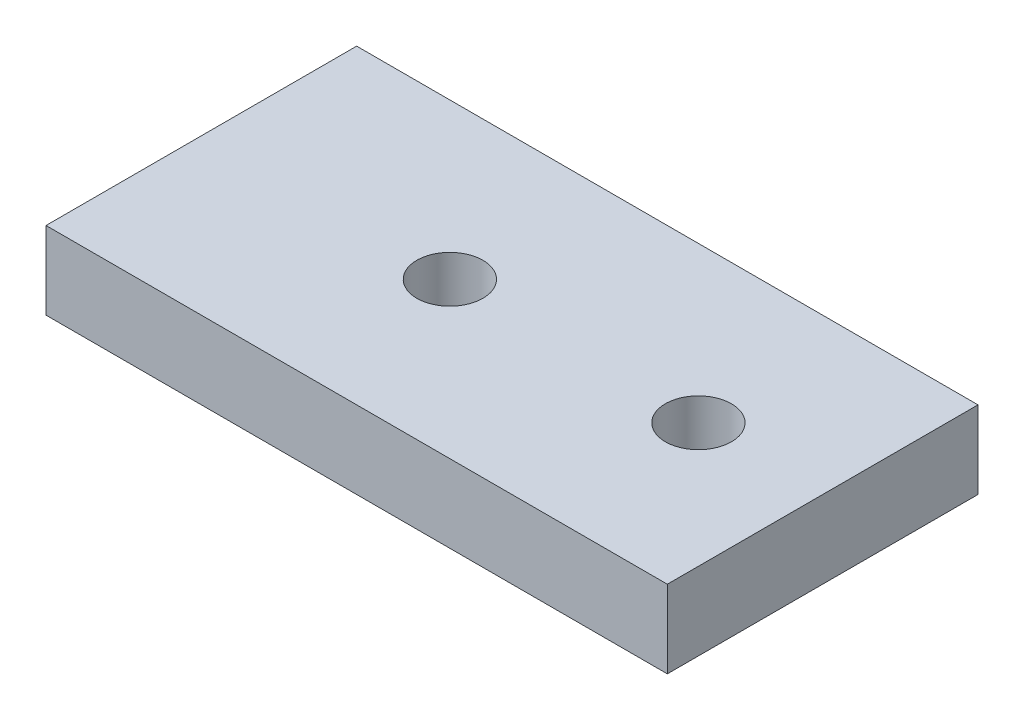
from build123d import *

# Parameters (mm, degrees)
SKETCH1_W           = 40
SKETCH1_H           = 20
SKETCH1_R           = 2.125
BOSS_EXTRUDE1_DEPTH = 5


with BuildPart() as part:
    # Sketch1 → Boss-Extrude1 (new body)
    with BuildSketch(Plane(origin=(0, 0, 0), x_dir=(1, 0, 0), z_dir=(0, 1, 0))):
        Rectangle(SKETCH1_W, SKETCH1_H)
        with Locations((12, 0)):
            Circle(SKETCH1_R, mode=Mode.SUBTRACT)
        with Locations((-4, 0)):
            Circle(SKETCH1_R, mode=Mode.SUBTRACT)
    extrude(amount=BOSS_EXTRUDE1_DEPTH)


solid = part.part
